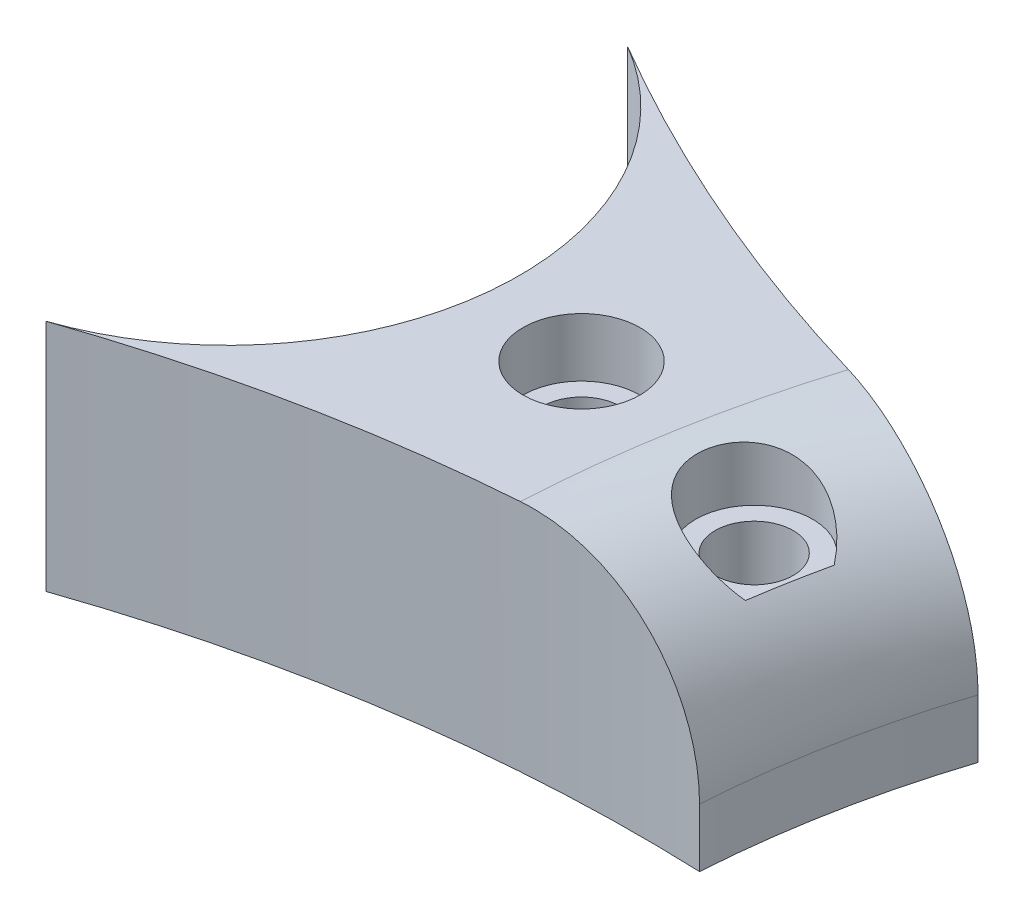
from build123d import *

# Parameters (mm, degrees)
SKETCH4_R           = 2
BOSS_EXTRUDE3_DEPTH = 12
SKETCH5_R           = 3
CUT_EXTRUDE1_DEPTH  = 3
FILLET2_R           = 9


with BuildPart() as part:
    # Sketch4 → Boss-Extrude3 (new body)
    with BuildSketch(Plane(origin=(0, 0, 0), x_dir=(1, 0, 0), z_dir=(0, 1, 0))):
        with BuildLine():
            ThreePointArc((-15.743367066, -13.557035328), (-1.346456096, -10.041025711), (13.451962467, -9.240914984))
            ThreePointArc((13.451962467, -9.240914984), (14.223098903, -3.176461435), (15.743367066, 2.744774328))
            ThreePointArc((15.743367066, 2.744774328), (0.886180468, 6.912573541), (-13.040688221, 13.557035328))
            ThreePointArc((-13.040688221, 13.557035328), (-5.710452271, -0.865362874), (-15.743367066, -13.557035328))
        make_face()
        with Locations(Location((-0.236677372, -1.605971843, 0), (0, 0, 270))):
            Circle(SKETCH4_R, mode=Mode.SUBTRACT)
        with Locations(Location((9.704188058, -2.691879069, 0), (0, 0, 270))):
            Circle(SKETCH4_R, mode=Mode.SUBTRACT)
    extrude(amount=BOSS_EXTRUDE3_DEPTH)

    # Sketch5 → Cut-Extrude1 (cut)
    with BuildSketch(Plane(origin=(0, 12, 0), x_dir=(1, 0, 0), z_dir=(0, 1, 0))):
        with Locations(Location((-0.236677372, -1.605971843, 0), (0, 0, 270))):
            Circle(SKETCH5_R)
        with Locations(Location((9.704188058, -2.691879069, 0), (0, 0, 270))):
            Circle(SKETCH5_R)
    extrude(amount=-CUT_EXTRUDE1_DEPTH, mode=Mode.SUBTRACT)

    # Fillet2
    # the kernel refuses this fillet: 9 mm, written as the material it takes off along each edge
    with BuildSketch(Plane(origin=(62.351465844, 12, 12.377564393), x_dir=(-0.9229460384493624, 0, 0.38492935729900885), z_dir=(0.38492935729900885, 0, 0.9229460384493624))) as fillet2_piece_1:
        with BuildLine():
            CenterArc((49 + FILLET2_R, FILLET2_R), FILLET2_R, 180, 90)
            Line((49 + FILLET2_R, 0), (49, 0))
            Line((49, 0), (49, FILLET2_R))
        make_face()
    revolve(axis=Axis((62.351465844, 12, 12.377564393), (0, -1, 0)), revolution_arc=66.924942426, mode=Mode.SUBTRACT)


solid = part.part
